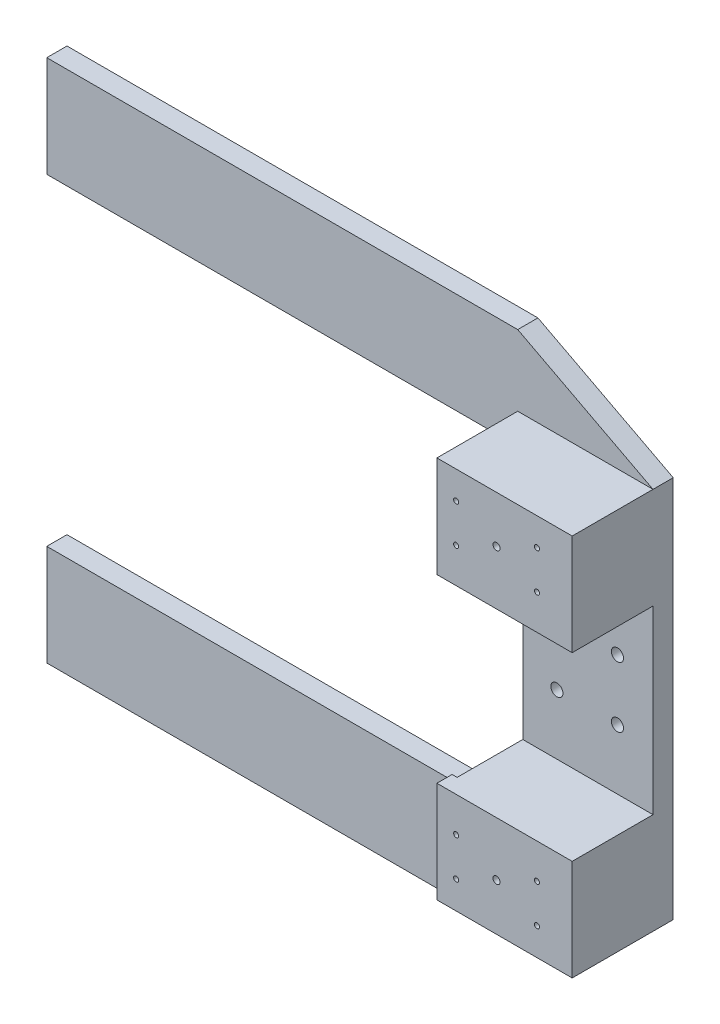
from build123d import *

# Parameters (mm, degrees)
SKETCH2_R            = 3.5
BOSS_EXTRUDE2_DEPTH  = 100
SKETCH4_W            = 133.89086021
SKETCH4_H            = 178.844782279
BOSS_EXTRUDE3_DEPTH  = 80
SKETCH4_2_W          = 133.89086021
SKETCH4_2_H          = 178.844782279
CUT_EXTRUDE1_DEPTH   = 80
SKETCH6_W            = 5
SKETCH6_H            = 300
CUT_EXTRUDE2_DEPTH   = 85
BOSS_EXTRUDE4_START  = -85
SKETCH9_R            = 3.5
BOSS_EXTRUDE4_DEPTH  = 85
SKETCH10_R           = 2.5
CUT_EXTRUDE14_DEPTH  = 30
SKETCH11_R           = 6
CUT_EXTRUDE15_DEPTH  = 10
SKETCH12_R           = 2.5
CUT_EXTRUDE16_DEPTH  = 10
BOSS_EXTRUDE5_DEPTH  = 466.11
BOSS_EXTRUDE6_DEPTH  = 20
BOSS_EXTRUDE7_DEPTH  = 466.11
BOSS_EXTRUDE8_DEPTH  = 20
SCALE2_START         = -100
SCALE2_OUTLINE_R     = 2.5
SCALE2_OUTLINE_R_2   = 0.0025
SCALE2_DEPTH         = 100
SCALE2_START_2       = -99.9
SCALE2_2_OUTLINE_R   = 0.0025
SCALE2_2_DEPTH       = 19.9
SCALE2_START_3       = -99.98
SCALE2_3_OUTLINE_W   = 0.12889086
SCALE2_3_OUTLINE_H   = 0.178844782
SCALE2_3_OUTLINE_R   = 0.0025
SCALE2_3_DEPTH       = 0.08
SCALE2_4_OUTLINE_W   = 0.005
SCALE2_4_OUTLINE_H   = 0.060577609
SCALE2_4_DEPTH       = 0.085
SCALE2_START_4       = -99.93
SCALE2_5_OUTLINE_R   = 0.0025
SCALE2_5_DEPTH       = 0.03
SCALE2_START_5       = -99.99
SCALE2_6_OUTLINE_R   = 0.006
SCALE2_6_OUTLINE_R_2 = 0.0025
SCALE2_6_DEPTH       = 0.01
SCALE2_START_6       = -99.915
SCALE2_7_OUTLINE_R   = 0.0035
SCALE2_7_DEPTH       = 0.015


# Read off the part's stored shape, not the designer's step: Scale2
with BuildPart() as part:
    # Sketch2 → Boss-Extrude2 (new body)
    with BuildSketch(Plane.XY):
        Polygon((1.000000002, -189.42239114), (1.000000002, 189.422391139), (134.890860212, 189.422391139), (134.890860212, 1.4e-08), (134.890860212, -189.42239114), align=None)
        with Locations((60, -143)):
            Circle(SKETCH2_R, mode=Mode.SUBTRACT)
        with Locations((60, 143)):
            Circle(SKETCH2_R, mode=Mode.SUBTRACT)
    extrude(amount=-BOSS_EXTRUDE2_DEPTH)

    # Sketch4 → Boss-Extrude3 (add)
    with BuildSketch(Plane.XY):
        with Locations((67.945430107, 0)):
            Rectangle(SKETCH4_W, SKETCH4_H)
    extrude(amount=-BOSS_EXTRUDE3_DEPTH)

    # Sketch4<2> → Cut-Extrude1 (cut)
    with BuildSketch(Plane.XY):
        with Locations((67.945430107, 0)):
            Rectangle(SKETCH4_2_W, SKETCH4_2_H)
    extrude(amount=-CUT_EXTRUDE1_DEPTH, mode=Mode.SUBTRACT)

    # Sketch6 → Cut-Extrude2 (cut)
    with BuildSketch(Plane(origin=(0, 0, -100), x_dir=(-1, 0, 0), z_dir=(0, 0, -1))):
        with Locations((-3.500000002, 0)):
            Rectangle(SKETCH6_W, SKETCH6_H)
    extrude(amount=-CUT_EXTRUDE2_DEPTH, mode=Mode.SUBTRACT)

    # Sketch9 → Boss-Extrude4 (add)
    with BuildSketch(Plane(origin=(0, 0, -100), x_dir=(-1, 0, 0), z_dir=(0, 0, -1)).offset(BOSS_EXTRUDE4_START)):
        with Locations(Location((-60, 143, 0), (0, 0, 180))):
            Circle(SKETCH9_R)
        with Locations(Location((-60, -143, 0), (0, 0, 180))):
            Circle(SKETCH9_R)
    extrude(amount=BOSS_EXTRUDE4_DEPTH)

    # Sketch10 → Cut-Extrude14 (cut)
    with BuildSketch(Plane.XY):
        with Locations((20.046580004, -162)):
            Circle(SKETCH10_R)
        with Locations((20.046580004, -124)):
            Circle(SKETCH10_R)
        with Locations((100.046580004, -124)):
            Circle(SKETCH10_R)
        with Locations((100.046580004, -162)):
            Circle(SKETCH10_R)
        with Locations((20.046580004, 124)):
            Circle(SKETCH10_R)
        with Locations((20.046580004, 162)):
            Circle(SKETCH10_R)
        with Locations((100.046580004, 162)):
            Circle(SKETCH10_R)
        with Locations((100.046580004, 124)):
            Circle(SKETCH10_R)
    extrude(amount=-CUT_EXTRUDE14_DEPTH, mode=Mode.SUBTRACT)

    # Sketch11 → Cut-Extrude15 (cut)
    with BuildSketch(Plane.XY.offset(-80)):
        with Locations((39.720690002, -30.000000885)):
            Circle(SKETCH11_R)
        with Locations((99.720690002, -30.000000885)):
            Circle(SKETCH11_R)
        with Locations((99.720690002, 29.999999115)):
            Circle(SKETCH11_R)
        with Locations((39.720690002, 29.999999115)):
            Circle(SKETCH11_R)
    extrude(amount=-CUT_EXTRUDE15_DEPTH, mode=Mode.SUBTRACT)

    # Sketch12 → Cut-Extrude16 (cut)
    with BuildSketch(Plane.XY.offset(-90)):
        with Locations((99.720690002, -30.000000885)):
            Circle(SKETCH12_R)
        with Locations((39.720690002, -30.000000885)):
            Circle(SKETCH12_R)
        with Locations((39.720690002, 29.999999115)):
            Circle(SKETCH12_R)
        with Locations((99.720690002, 29.999999115)):
            Circle(SKETCH12_R)
    extrude(amount=-CUT_EXTRUDE16_DEPTH, mode=Mode.SUBTRACT)

    # Sketch13 → Boss-Extrude5 (add)
    with BuildSketch(Plane.ZY.offset(-1.000000002)):
        Polygon((-100, 189.422391139), (-100, 159.422391139), (-80, 159.422391139), (-80, 189.422391139), (-80, 259.422391139), (-100, 259.422391139), align=None)
    extrude(amount=BOSS_EXTRUDE5_DEPTH)

    # Sketch14 → Boss-Extrude6 (add)
    with BuildSketch(Plane(origin=(0, 0, -100), x_dir=(-1, 0, 0), z_dir=(0, 0, -1))):
        Polygon((-134.890860212, 189.422391139), (-1.000000002, 259.422391139), (-1.000000002, 189.422391139), align=None)
    extrude(amount=-BOSS_EXTRUDE6_DEPTH)

    # Sketch15 → Boss-Extrude7 (add)
    with BuildSketch(Plane.ZY.offset(-1.000000002)):
        Polygon((-100, -189.42239114), (-100, -159.42239114), (-80, -159.42239114), (-80, -189.42239114), (-80, -259.42239114), (-100, -259.42239114), align=None)
    extrude(amount=BOSS_EXTRUDE7_DEPTH)

    # Sketch16 → Boss-Extrude8 (add)
    with BuildSketch(Plane(origin=(0, 0, -100), x_dir=(-1, 0, 0), z_dir=(0, 0, -1))):
        Polygon((-134.890860212, -189.42239114), (-1.000000002, -259.42239114), (-1.000000002, -189.42239114), align=None)
    extrude(amount=-BOSS_EXTRUDE8_DEPTH)

    # Scale2 outline → Scale2 (cut)
    # profile 1 of 6: a face of its own
    with BuildSketch(Plane.XY.offset(SCALE2_START)):
        Polygon((-464.643889998, -259.32239114), (-464.643889998, -259.25239114), (-464.638889998, -259.25239114), (-464.638889998, -259.073546358), (-464.643889998, -259.073546358), (-464.643889998, -259.003546358), (-465.109999998, -259.003546358), (-465.109999998, -259.32239114), align=None)
    # profile 2 of 6: a face of its own
    with BuildSketch(Plane.XY.offset(SCALE2_START)):
        Polygon((-464.509999138, -259.35239114), (-464.643889998, -259.42239114), (1.000000002, -259.42239114), (134.890860212, -189.42239114), (134.890860212, 189.422391139), (1.000000002, 259.422391139), (-465.109999998, 259.422391139), (-465.109999998, 159.422391139), (1.000000002, 159.422391139), (1.000000002, 89.422391139), (6.000000002, 89.422391139), (6.000000002, -89.42239114), (1.000000002, -89.42239114), (1.000000002, -159.42239114), (-465.109999998, -159.42239114), (-465.109999998, -258.903546358), (-464.643889998, -258.903546358), (-464.509999138, -258.973546358), align=None)
        with Locations((99.720690002, 29.999999115)):
            Circle(SCALE2_OUTLINE_R, mode=Mode.SUBTRACT)
        with Locations((39.720690002, -30.000000885)):
            Circle(SCALE2_OUTLINE_R, mode=Mode.SUBTRACT)
        with Locations((99.720690002, -30.000000885)):
            Circle(SCALE2_OUTLINE_R, mode=Mode.SUBTRACT)
        with Locations((39.720690002, 29.999999115)):
            Circle(SCALE2_OUTLINE_R, mode=Mode.SUBTRACT)
    # profile 3 of 6: a face of its own
    with BuildSketch(Plane.XY.offset(SCALE2_START)):
        with Locations((-464.545169308, -259.19296875)):
            Circle(SCALE2_OUTLINE_R_2)
    # profile 4 of 6: a face of its own
    with BuildSketch(Plane.XY.offset(SCALE2_START)):
        with Locations((-464.605169308, -259.19296875)):
            Circle(SCALE2_OUTLINE_R_2)
    # profile 5 of 6: a face of its own
    with BuildSketch(Plane.XY.offset(SCALE2_START)):
        with Locations((-464.605169308, -259.13296875)):
            Circle(SCALE2_OUTLINE_R_2)
    # profile 6 of 6: a face of its own
    with BuildSketch(Plane.XY.offset(SCALE2_START)):
        with Locations((-464.545169308, -259.13296875)):
            Circle(SCALE2_OUTLINE_R_2)
    extrude(amount=SCALE2_DEPTH, mode=Mode.SUBTRACT)

    # Scale2 2 outline → Scale2 2 (cut)
    with BuildSketch(Plane.XY.offset(SCALE2_START_2)):
        Polygon((-464.638889998, -259.25239114), (-464.643889998, -259.25239114), (-464.643889998, -259.32239114), (-465.109999998, -259.32239114), (-465.109999998, -259.42239114), (-464.643889998, -259.42239114), (-464.509999138, -259.35239114), (-464.509999138, -258.973546358), (-464.643889998, -258.903546358), (-465.109999998, -258.903546358), (-465.109999998, -259.003546358), (-464.643889998, -259.003546358), (-464.643889998, -259.073546358), (-464.638889998, -259.073546358), align=None)
        with Locations((-464.605169308, -259.13296875)):
            Circle(SCALE2_2_OUTLINE_R, mode=Mode.SUBTRACT)
        with Locations((-464.605169308, -259.19296875)):
            Circle(SCALE2_2_OUTLINE_R, mode=Mode.SUBTRACT)
        with Locations((-464.545169308, -259.19296875)):
            Circle(SCALE2_2_OUTLINE_R, mode=Mode.SUBTRACT)
        with Locations((-464.545169308, -259.13296875)):
            Circle(SCALE2_2_OUTLINE_R, mode=Mode.SUBTRACT)
    extrude(amount=SCALE2_2_DEPTH, mode=Mode.SUBTRACT)

    # Scale2 3 outline → Scale2 3 (cut)
    # profile 1 of 3: a face of its own
    with BuildSketch(Plane.XY.offset(SCALE2_START_3)):
        with Locations((-464.574444568, -259.162968749)):
            Rectangle(SCALE2_3_OUTLINE_W, SCALE2_3_OUTLINE_H)
        with Locations((-464.605169308, -259.19296875)):
            Circle(SCALE2_3_OUTLINE_R, mode=Mode.SUBTRACT)
        with Locations((-464.545169308, -259.19296875)):
            Circle(SCALE2_3_OUTLINE_R, mode=Mode.SUBTRACT)
        with Locations((-464.545169308, -259.13296875)):
            Circle(SCALE2_3_OUTLINE_R, mode=Mode.SUBTRACT)
        with Locations((-464.605169308, -259.13296875)):
            Circle(SCALE2_3_OUTLINE_R, mode=Mode.SUBTRACT)
    # profile 2 of 3: a face of its own
    with BuildSketch(Plane.XY.offset(SCALE2_START_3)):
        Polygon((-464.643889998, -259.35239114), (-464.643889998, -259.32239114), (-465.109999998, -259.32239114), (-465.109999998, -259.42239114), (-464.643889998, -259.42239114), (-464.509999138, -259.35239114), align=None)
    # profile 3 of 3: a face of its own
    with BuildSketch(Plane.XY.offset(SCALE2_START_3)):
        Polygon((-465.109999998, -258.903546358), (-465.109999998, -259.003546358), (-464.643889998, -259.003546358), (-464.643889998, -258.973546358), (-464.509999138, -258.973546358), (-464.643889998, -258.903546358), align=None)
    extrude(amount=SCALE2_3_DEPTH, mode=Mode.SUBTRACT)

    # Scale2 4 outline → Scale2 4 (cut)
    with BuildSketch(Plane.XY.offset(SCALE2_START)):
        with Locations((-464.641389998, -259.282679945)):
            Rectangle(SCALE2_4_OUTLINE_W, SCALE2_4_OUTLINE_H)
        with Locations((-464.641389998, -259.043257554)):
            Rectangle(SCALE2_4_OUTLINE_W, SCALE2_4_OUTLINE_H)
    extrude(amount=SCALE2_4_DEPTH, mode=Mode.SUBTRACT)

    # Scale2 5 outline → Scale2 5 (cut)
    with BuildSketch(Plane.XY.offset(SCALE2_START_4)):
        with Locations((-464.624843418, -259.324968749)):
            Circle(SCALE2_5_OUTLINE_R)
        with Locations((-464.624843418, -259.286968749)):
            Circle(SCALE2_5_OUTLINE_R)
        with Locations((-464.544843418, -259.286968749)):
            Circle(SCALE2_5_OUTLINE_R)
        with Locations((-464.544843418, -259.324968749)):
            Circle(SCALE2_5_OUTLINE_R)
        with Locations((-464.624843418, -259.038968749)):
            Circle(SCALE2_5_OUTLINE_R)
        with Locations((-464.624843418, -259.000968749)):
            Circle(SCALE2_5_OUTLINE_R)
        with Locations((-464.544843418, -259.000968749)):
            Circle(SCALE2_5_OUTLINE_R)
        with Locations((-464.544843418, -259.038968749)):
            Circle(SCALE2_5_OUTLINE_R)
    extrude(amount=SCALE2_5_DEPTH, mode=Mode.SUBTRACT)

    # Scale2 6 outline → Scale2 6 (cut)
    # profile 1 of 4: a face of its own
    with BuildSketch(Plane.XY.offset(SCALE2_START_5)):
        with Locations((-464.605169308, -259.19296875)):
            Circle(SCALE2_6_OUTLINE_R)
        with Locations((-464.605169308, -259.19296875)):
            Circle(SCALE2_6_OUTLINE_R_2, mode=Mode.SUBTRACT)
    # profile 2 of 4: a face of its own
    with BuildSketch(Plane.XY.offset(SCALE2_START_5)):
        with Locations((-464.545169308, -259.19296875)):
            Circle(SCALE2_6_OUTLINE_R)
        with Locations((-464.545169308, -259.19296875)):
            Circle(SCALE2_6_OUTLINE_R_2, mode=Mode.SUBTRACT)
    # profile 3 of 4: a face of its own
    with BuildSketch(Plane.XY.offset(SCALE2_START_5)):
        with Locations((-464.545169308, -259.13296875)):
            Circle(SCALE2_6_OUTLINE_R)
        with Locations((-464.545169308, -259.13296875)):
            Circle(SCALE2_6_OUTLINE_R_2, mode=Mode.SUBTRACT)
    # profile 4 of 4: a face of its own
    with BuildSketch(Plane.XY.offset(SCALE2_START_5)):
        with Locations((-464.605169308, -259.13296875)):
            Circle(SCALE2_6_OUTLINE_R)
        with Locations((-464.605169308, -259.13296875)):
            Circle(SCALE2_6_OUTLINE_R_2, mode=Mode.SUBTRACT)
    extrude(amount=SCALE2_6_DEPTH, mode=Mode.SUBTRACT)

    # Scale2 7 outline → Scale2 7 (cut)
    with BuildSketch(Plane.XY.offset(SCALE2_START_6)):
        with Locations((-464.584889998, -259.305968749)):
            Circle(SCALE2_7_OUTLINE_R)
        with Locations((-464.584889998, -259.019968749)):
            Circle(SCALE2_7_OUTLINE_R)
    extrude(amount=SCALE2_7_DEPTH, mode=Mode.SUBTRACT)


solid = part.part
